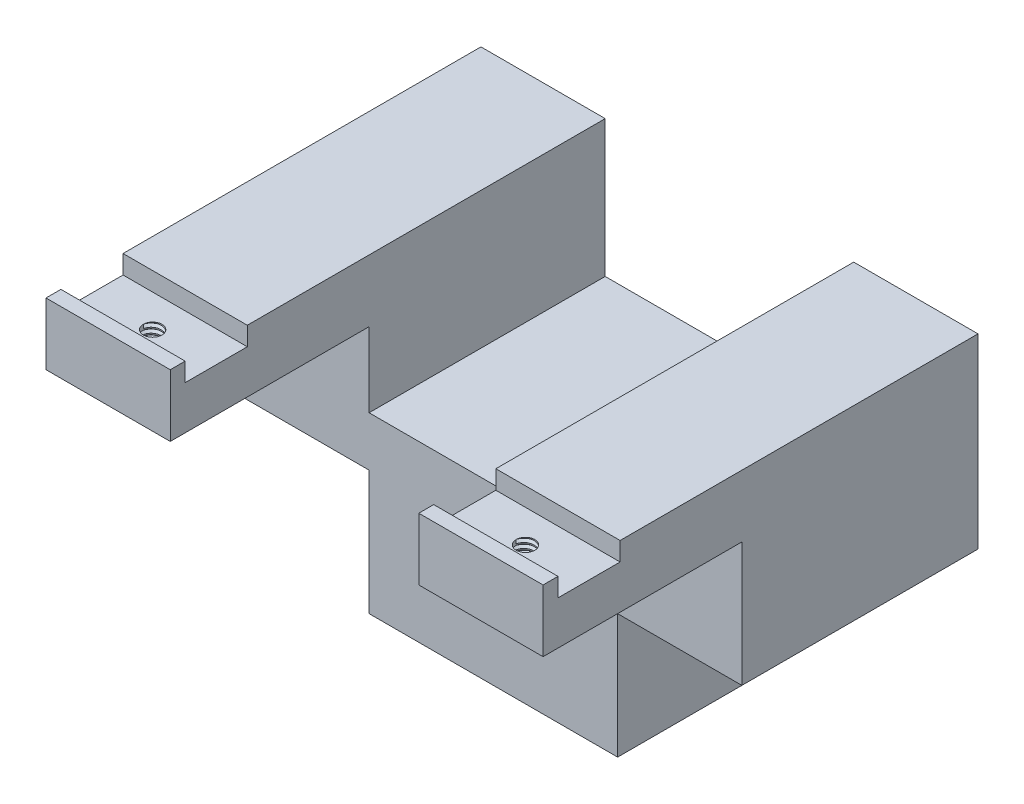
from build123d import *
from build123d.topology import SkipClean

# Parameters (mm, degrees)
SKETCH1_W           = 101.6
SKETCH1_H           = 88.9
BOSS_EXTRUDE1_DEPTH = 63.5
SKETCH2_W           = 40.64
SKETCH2_H           = 25.4
CUT_EXTRUDE1_DEPTH  = 101.6
SKETCH3_W           = 12.7
SKETCH3_H           = 3.81
CUT_EXTRUDE2_DEPTH  = 101.6
SKETCH5_W           = 50.8
SKETCH5_H           = 27.94
CUT_EXTRUDE3_DEPTH  = 101.6
SKETCH7_W           = 25.4
SKETCH7_H           = 25.4
CUT_EXTRUDE4_DEPTH  = 101.6
SKETCH8_W           = 25.4
SKETCH8_H           = 25.4
CUT_EXTRUDE5_DEPTH  = 101.6
SKETCH9_W           = 40.64
SKETCH9_H           = 25.4
CUT_EXTRUDE6_DEPTH  = 101.6
SKETCH10_R          = 1.905
CUT_EXTRUDE7_DEPTH  = 12.7
THREAD1_PITCH       = 1.058333
THREAD2_PITCH       = 1.058333
SKETCH17_R          = 3.175
CUT_EXTRUDE8_DEPTH  = 19.05
THREAD3_PITCH       = 1.27


with BuildPart() as part:
    # Sketch1 → Boss-Extrude1 (new body)
    with BuildSketch(Plane(origin=(0, 0, 0), x_dir=(1, 0, 0), z_dir=(0, 1, 0))):
        Rectangle(SKETCH1_W, SKETCH1_H)
    extrude(amount=BOSS_EXTRUDE1_DEPTH)

    # Sketch2 → Cut-Extrude1 (cut)
    with BuildSketch(Plane(origin=(50.8, 0, 0), x_dir=(0, 0, -1), z_dir=(1, 0, 0))):
        with Locations((-24.13, 12.7)):
            Rectangle(SKETCH2_W, SKETCH2_H)
    extrude(amount=-CUT_EXTRUDE1_DEPTH, mode=Mode.SUBTRACT)

    # Sketch3 → Cut-Extrude2 (cut)
    with BuildSketch(Plane(origin=(50.8, 0, 0), x_dir=(0, 0, -1), z_dir=(1, 0, 0))):
        with Locations((-35.052, 61.595)):
            Rectangle(SKETCH3_W, SKETCH3_H)
    extrude(amount=-CUT_EXTRUDE2_DEPTH, mode=Mode.SUBTRACT)

    # Sketch5 → Cut-Extrude3 (cut)
    with BuildSketch(Plane.XY.offset(44.45)):
        with Locations((0, 49.53)):
            Rectangle(SKETCH5_W, SKETCH5_H)
    extrude(amount=-CUT_EXTRUDE3_DEPTH, mode=Mode.SUBTRACT)

    # Sketch7 → Cut-Extrude4 (cut)
    with BuildSketch(Plane(origin=(0, 0, -44.45), x_dir=(-1, 0, 0), z_dir=(0, 0, -1))):
        with Locations((-38.1, 12.7)):
            Rectangle(SKETCH7_W, SKETCH7_H)
    extrude(amount=-CUT_EXTRUDE4_DEPTH, mode=Mode.SUBTRACT)

    # Sketch8 → Cut-Extrude5 (cut)
    with BuildSketch(Plane(origin=(0, 0, -44.45), x_dir=(-1, 0, 0), z_dir=(0, 0, -1))):
        with Locations((38.1, 12.7)):
            Rectangle(SKETCH8_W, SKETCH8_H)
    extrude(amount=-CUT_EXTRUDE5_DEPTH, mode=Mode.SUBTRACT)

    # Sketch9 → Cut-Extrude6 (cut)
    with BuildSketch(Plane(origin=(50.8, 0, 0), x_dir=(0, 0, -1), z_dir=(1, 0, 0))):
        with Locations((-24.13, 38.1)):
            Rectangle(SKETCH9_W, SKETCH9_H)
    extrude(amount=-CUT_EXTRUDE6_DEPTH, mode=Mode.SUBTRACT)

    # Sketch10 → Cut-Extrude7 (cut)
    with BuildSketch(Plane(origin=(0, 59.69, 0), x_dir=(1, 0, 0), z_dir=(0, 1, 0))):
        with Locations(Location((-38.1, -35.347808, 0), (0, 0, 270))):
            Circle(SKETCH10_R)
        with Locations(Location((38.1, -35.347808, 0), (0, 0, 270))):
            Circle(SKETCH10_R)
    extrude(amount=-CUT_EXTRUDE7_DEPTH, mode=Mode.SUBTRACT)

    # Thread1: arcs per turn and ends read off the stored shape
    # Thread1: the profile of Thread Profile1 profile screwed along a right-hand helix through 9.448819 turns, 8 arcs to a turn; built about Z, then put on its axis
    thread1_z = Axis((0, 0, 0), (0, 0, 1))
    thread1_corners = [(1.9047, 0, -0.000173), (2.47784, 0, 0.330729), (2.47784, 0, 0.463021), (1.9047, 0, 0.793923)]
    with BuildLine(mode=Mode.PRIVATE) as thread1_profile:
        Line(thread1_corners[0], thread1_corners[1])
        Line(thread1_corners[1], thread1_corners[2])
        Line(thread1_corners[2], thread1_corners[3])
        Line(thread1_corners[3], thread1_corners[0])
    thread1_cap = Face(thread1_profile.wire())
    thread1_turn_angles = [0, 22.5, 45, 67.5, 90, 112.5, 135, 157.5, 180, 202.5, 225, 247.5, 270, 292.5, 315, 337.5, 360]
    thread1_turn_weights = [1, 0.9238795325112867, 1, 0.9238795325112867, 1, 0.9238795325112867, 1, 0.9238795325112867, 1, 0.9238795325112867, 1, 0.9238795325112867, 1, 0.9238795325112867, 1, 0.9238795325112867, 1]
    thread1_turn_rails = [Edge.make_bspline([Vector(p[0], p[1], 0).rotate(thread1_z, thread1_turn_angles[k]) / thread1_turn_weights[k] + Vector(0, 0, p[2] + THREAD1_PITCH * thread1_turn_angles[k] / 360) for k in range(17)], [0, 0, 0, 1, 1, 2, 2, 3, 3, 4, 4, 5, 5, 6, 6, 7, 7, 8, 8, 8], 2, thread1_turn_weights) for p in thread1_corners]
    thread1_turn_sides = [Face.make_surface_from_curves(thread1_turn_rails[p[0]], thread1_turn_rails[p[1]]) for p in [(0, 1), (1, 2), (2, 3), (3, 0)]]
    thread1_last_angles = [3240, 3262.5, 3285, 3307.5, 3330, 3352.5, 3375, 3388.287402, 3401.574803]
    thread1_last_weights = [1, 0.9238795325112867, 1, 0.9238795325112867, 1, 0.9238795325112867, 1, 0.9732294335070495, 1]
    thread1_last_rails = [Edge.make_bspline([Vector(p[0], p[1], 0).rotate(thread1_z, thread1_last_angles[k]) / thread1_last_weights[k] + Vector(0, 0, p[2] + THREAD1_PITCH * thread1_last_angles[k] / 360) for k in range(9)], [0, 0, 0, 1, 1, 2, 2, 3, 3, 4, 4, 4], 2, thread1_last_weights) for p in thread1_corners]
    thread1_last_sides = [Face.make_surface_from_curves(thread1_last_rails[p[0]], thread1_last_rails[p[1]]) for p in [(0, 1), (1, 2), (2, 3), (3, 0)]]
    thread1 = Plane(origin=(-38.1, 59.69, 35.347808), x_dir=(-1, 0, 0), z_dir=(0, -1, 0)) * Solid(Shell([*[p.moved(Location((0, 0, THREAD1_PITCH * i))) for i in range(9) for p in thread1_turn_sides], *thread1_last_sides, thread1_cap, thread1_cap.rotate(thread1_z, 3401.574803).moved(Location((0, 0, THREAD1_PITCH * 3401.574803 / 360)))]))
    add(thread1, mode=Mode.SUBTRACT)

    # Thread2: arcs per turn and ends read off the stored shape
    # Thread2: the profile of Thread Profile2 profile screwed along a right-hand helix through 9.448819 turns, 8 arcs to a turn; built about Z, then put on its axis
    thread2_z = Axis((0, 0, 0), (0, 0, 1))
    thread2_corners = [(1.9047, 0, -0.000173), (2.47784, 0, 0.330729), (2.47784, 0, 0.463021), (1.9047, 0, 0.793923)]
    with BuildLine(mode=Mode.PRIVATE) as thread2_profile:
        Line(thread2_corners[0], thread2_corners[1])
        Line(thread2_corners[1], thread2_corners[2])
        Line(thread2_corners[2], thread2_corners[3])
        Line(thread2_corners[3], thread2_corners[0])
    thread2_cap = Face(thread2_profile.wire())
    thread2_turn_angles = [0, 22.5, 45, 67.5, 90, 112.5, 135, 157.5, 180, 202.5, 225, 247.5, 270, 292.5, 315, 337.5, 360]
    thread2_turn_weights = [1, 0.9238795325112867, 1, 0.9238795325112867, 1, 0.9238795325112867, 1, 0.9238795325112867, 1, 0.9238795325112867, 1, 0.9238795325112867, 1, 0.9238795325112867, 1, 0.9238795325112867, 1]
    thread2_turn_rails = [Edge.make_bspline([Vector(p[0], p[1], 0).rotate(thread2_z, thread2_turn_angles[k]) / thread2_turn_weights[k] + Vector(0, 0, p[2] + THREAD2_PITCH * thread2_turn_angles[k] / 360) for k in range(17)], [0, 0, 0, 1, 1, 2, 2, 3, 3, 4, 4, 5, 5, 6, 6, 7, 7, 8, 8, 8], 2, thread2_turn_weights) for p in thread2_corners]
    thread2_turn_sides = [Face.make_surface_from_curves(thread2_turn_rails[p[0]], thread2_turn_rails[p[1]]) for p in [(0, 1), (1, 2), (2, 3), (3, 0)]]
    thread2_last_angles = [3240, 3262.5, 3285, 3307.5, 3330, 3352.5, 3375, 3388.287402, 3401.574803]
    thread2_last_weights = [1, 0.9238795325112867, 1, 0.9238795325112867, 1, 0.9238795325112867, 1, 0.9732294335070495, 1]
    thread2_last_rails = [Edge.make_bspline([Vector(p[0], p[1], 0).rotate(thread2_z, thread2_last_angles[k]) / thread2_last_weights[k] + Vector(0, 0, p[2] + THREAD2_PITCH * thread2_last_angles[k] / 360) for k in range(9)], [0, 0, 0, 1, 1, 2, 2, 3, 3, 4, 4, 4], 2, thread2_last_weights) for p in thread2_corners]
    thread2_last_sides = [Face.make_surface_from_curves(thread2_last_rails[p[0]], thread2_last_rails[p[1]]) for p in [(0, 1), (1, 2), (2, 3), (3, 0)]]
    thread2 = Plane(origin=(38.1, 59.69, 35.347808), x_dir=(-1, 0, 0), z_dir=(0, -1, 0)) * Solid(Shell([*[p.moved(Location((0, 0, THREAD2_PITCH * i))) for i in range(9) for p in thread2_turn_sides], *thread2_last_sides, thread2_cap, thread2_cap.rotate(thread2_z, 3401.574803).moved(Location((0, 0, THREAD2_PITCH * 3401.574803 / 360)))]))
    add(thread2, mode=Mode.SUBTRACT)

    # Sketch17 → Cut-Extrude8 (cut)
    with BuildSketch(Plane.XZ):
        with Locations(Location((0, -20.32, 0), (0, 0, 270))):
            Circle(SKETCH17_R)
    extrude(amount=-CUT_EXTRUDE8_DEPTH, mode=Mode.SUBTRACT)

    # Thread3: arcs per turn and ends read off the stored shape
    # Thread3: the profile of Thread Profile3 profile screwed along a right-hand helix through 7.874016 turns, 8 arcs to a turn; built about Z, then put on its axis
    with SkipClean():  # the faces are left unmerged after this step: merging them gives an invalid solid
        thread3_z = Axis((0, 0, 0), (0, 0, 1))
        thread3_corners = [(3.1747, 0, -0.000173), (3.862408, 0, 0.396875), (3.862408, 0, 0.555625), (3.1747, 0, 0.952673)]
        with BuildLine(mode=Mode.PRIVATE) as thread3_profile:
            Line(thread3_corners[0], thread3_corners[1])
            Line(thread3_corners[1], thread3_corners[2])
            Line(thread3_corners[2], thread3_corners[3])
            Line(thread3_corners[3], thread3_corners[0])
        thread3_cap = Face(thread3_profile.wire())
        thread3_turn_angles = [0, 22.5, 45, 67.5, 90, 112.5, 135, 157.5, 180, 202.5, 225, 247.5, 270, 292.5, 315, 337.5, 360]
        thread3_turn_weights = [1, 0.9238795325112867, 1, 0.9238795325112867, 1, 0.9238795325112867, 1, 0.9238795325112867, 1, 0.9238795325112867, 1, 0.9238795325112867, 1, 0.9238795325112867, 1, 0.9238795325112867, 1]
        thread3_turn_rails = [Edge.make_bspline([Vector(p[0], p[1], 0).rotate(thread3_z, thread3_turn_angles[k]) / thread3_turn_weights[k] + Vector(0, 0, p[2] + THREAD3_PITCH * thread3_turn_angles[k] / 360) for k in range(17)], [0, 0, 0, 1, 1, 2, 2, 3, 3, 4, 4, 5, 5, 6, 6, 7, 7, 8, 8, 8], 2, thread3_turn_weights) for p in thread3_corners]
        thread3_turn_sides = [Face.make_surface_from_curves(thread3_turn_rails[p[0]], thread3_turn_rails[p[1]]) for p in [(0, 1), (1, 2), (2, 3), (3, 0)]]
        thread3_last_angles = [2520, 2542.5, 2565, 2587.5, 2610, 2632.5, 2655, 2677.5, 2700, 2722.5, 2745, 2767.5, 2790, 2812.322835, 2834.645669]
        thread3_last_weights = [1, 0.9238795325112867, 1, 0.9238795325112867, 1, 0.9238795325112867, 1, 0.9238795325112867, 1, 0.9238795325112867, 1, 0.9238795325112867, 1, 0.9250584165493104, 1]
        thread3_last_rails = [Edge.make_bspline([Vector(p[0], p[1], 0).rotate(thread3_z, thread3_last_angles[k]) / thread3_last_weights[k] + Vector(0, 0, p[2] + THREAD3_PITCH * thread3_last_angles[k] / 360) for k in range(15)], [0, 0, 0, 1, 1, 2, 2, 3, 3, 4, 4, 5, 5, 6, 6, 7, 7, 7], 2, thread3_last_weights) for p in thread3_corners]
        thread3_last_sides = [Face.make_surface_from_curves(thread3_last_rails[p[0]], thread3_last_rails[p[1]]) for p in [(0, 1), (1, 2), (2, 3), (3, 0)]]
        thread3 = Plane(origin=(0, 0, -20.32), x_dir=(1, 0, 0), z_dir=(0, 1, 0)) * Solid(Shell([*[p.moved(Location((0, 0, THREAD3_PITCH * i))) for i in range(7) for p in thread3_turn_sides], *thread3_last_sides, thread3_cap, thread3_cap.rotate(thread3_z, 2834.645669).moved(Location((0, 0, THREAD3_PITCH * 2834.645669 / 360)))]))
        add(thread3, mode=Mode.SUBTRACT)


solid = part.part
